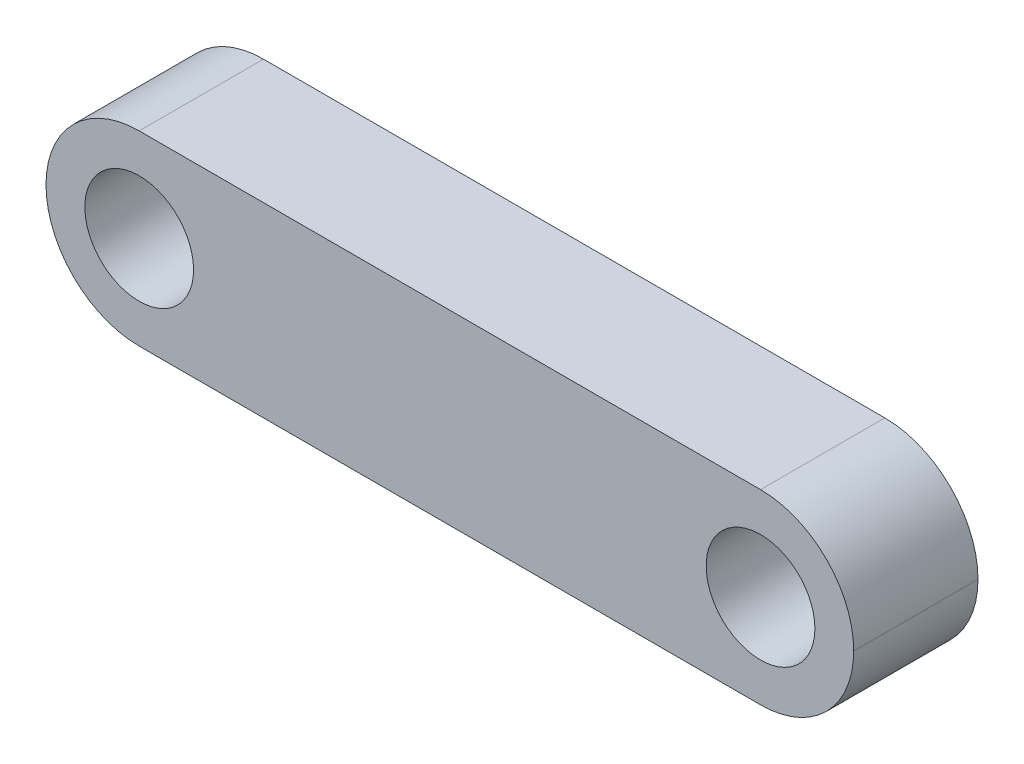
from build123d import *

# Parameters (mm, degrees)
CROQUIS1_W              = 26
CROQUIS1_H              = 6
CROQUIS1_R              = 1.75
SALIENTE_EXTRUIR1_DEPTH = 4
REDONDEO2_R             = 3


with BuildPart() as part:
    # Croquis1 → Saliente-Extruir1 (new body)
    with BuildSketch(Plane.XY):
        with Locations((-8.309993141, 2.824852585)):
            Rectangle(CROQUIS1_W, CROQUIS1_H)
        with Locations((1.690006859, 2.824852585)):
            Circle(CROQUIS1_R, mode=Mode.SUBTRACT)
        with Locations((-18.309993141, 2.824852585)):
            Circle(CROQUIS1_R, mode=Mode.SUBTRACT)
    extrude(amount=SALIENTE_EXTRUIR1_DEPTH)

    # Redondeo2
    redondeo2_edges = [part.edges().sort_by_distance(p)[0] for p in [
        (4.690006859, 5.824852585, 2),
        (4.690006859, -0.175147415, 2),
        (-21.309993141, 5.824852585, 2),
        (-21.309993141, -0.175147415, 2),
    ]]
    fillet(redondeo2_edges, radius=REDONDEO2_R - 0.0001)  # a hair under: the kernel refuses the full size


solid = part.part
